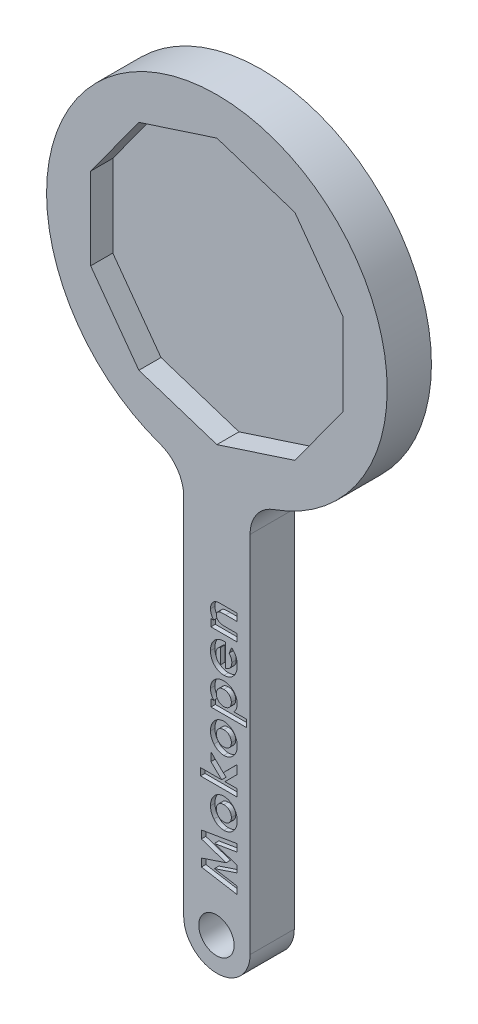
from build123d import *

# Parameters (mm, degrees)
SCHIZZO1_R                   = 4
ESTRUSIONE_ESTRUSIONE1_DEPTH = 10
TAGLIO_ESTRUSIONE1_DEPTH     = 5
TAGLIO_ESTRUSIONE2_START     = 9
TAGLIO_ESTRUSIONE2_DEPTH     = 1


# Read off the part's stored shape, not the designer's step: Taglio-Estrusione2
with BuildPart() as part:
    # Schizzo1 → Estrusione-Estrusione1 (new body)
    with BuildSketch(Plane.XY):
        with BuildLine():
            Line((-7.5, -43.840620434), (-7.5, -126.1))
            ThreePointArc((-7.5, -126.1), (-5.332590181, -131.332590181), (-0.1, -133.5))
            Line((-0.1, -133.5), (0.1, -133.5))
            ThreePointArc((0.1, -133.5), (5.332590181, -131.332590181), (7.5, -126.1))
            Line((7.5, -126.1), (7.5, -43.840620434))
            ThreePointArc((7.5, -43.840620434), (8.968027353, -39.22181828), (12.833333333, -36.298148101))
            ThreePointArc((12.833333333, -36.298148101), (0, 38.5), (-12.833333333, -36.298148101))
            ThreePointArc((-12.833333333, -36.298148101), (-8.968027353, -39.22181828), (-7.5, -43.840620434))
        make_face()
        with Locations((-0.1, -126.1)):
            Circle(SCHIZZO1_R, mode=Mode.SUBTRACT)
    extrude(amount=ESTRUSIONE_ESTRUSIONE1_DEPTH)

    # Schizzo3 → Taglio-Estrusione1 (cut)
    with BuildSketch(Plane.XY.offset(10)):
        Polygon((0, -30), (17.633557569, -24.270509831), (28.531695489, -9.270509831), (28.531695489, 9.270509831), (17.633557569, 24.270509831), (0, 30), (-17.633557569, 24.270509831), (-28.531695489, 9.270509831), (-28.531695489, -9.270509831), (-17.633557569, -24.270509831), align=None)
    extrude(amount=-TAGLIO_ESTRUSIONE1_DEPTH, mode=Mode.SUBTRACT)

    # Taglio-Estrusione2 outline → Taglio-Estrusione2 (cut)
    # profile 1 of 7: a face of its own
    with BuildSketch(Plane.XY.offset(TAGLIO_ESTRUSIONE2_START)):
        with BuildLine():
            add(Edge.make_bspline(
                [(-0.727564103, -64.715384615), (-0.791230464, -64.628577828), (-0.912682665, -64.462982133), (-1.06886137, -64.212550361), (-1.197241016, -63.976467599), (-1.293635916, -63.748099177), (-1.363799756, -63.525195402), (-1.411046694, -63.302362359), (-1.443701724, -63.077992027), (-1.447046489, -62.927037959), (-1.448717949, -62.851602564)],
                knots=[0, 0, 0, 0, 0.158475496, 0.302313455, 0.4342849, 0.553795562, 0.666749821, 0.77784251, 0.888982535, 1, 1, 1, 1], degree=3))
            Line((-0.727564103, -64.715384615), (-1.346153846, -64.715384615))
            Line((-1.346153846, -64.715384615), (-1.346153846, -66.356410256))
            Line((-1.346153846, -66.356410256), (4.5, -66.356410256))
            Line((4.5, -66.356410256), (4.5, -64.715384615))
            Line((4.5, -64.715384615), (2.173076923, -64.715384615))
            add(Edge.make_bspline(
                [(0.996794872, -64.648076923), (1.022897257, -64.653854389), (1.081110823, -64.666739301), (1.1794566, -64.677329025), (1.296661866, -64.692164903), (1.433795403, -64.697474402), (1.590700772, -64.707262655), (1.767088391, -64.710734034), (1.963659968, -64.714313386), (2.100958688, -64.715015709), (2.173076923, -64.715384615)],
                knots=[0, 0, 0, 0, 0.067920311, 0.151475949, 0.251213346, 0.36821016, 0.500124119, 0.650932111, 0.816646797, 1, 1, 1, 1], degree=3))
            add(Edge.make_bspline(
                [(-0.115384615, -63.393269231), (-0.111594302, -63.46784717), (-0.104179712, -63.613736118), (-0.04850242, -63.824834571), (0.046677616, -64.018051013), (0.176043741, -64.19407126), (0.338563785, -64.348658521), (0.532993404, -64.47503314), (0.753075068, -64.580006283), (0.913665181, -64.624858903), (0.996794872, -64.648076923)],
                knots=[0, 0, 0, 0, 0.122997731, 0.240607473, 0.357315011, 0.476513259, 0.599359242, 0.725282592, 0.857792159, 1, 1, 1, 1], degree=3))
            add(Edge.make_bspline(
                [(1.961538462, -62.356410256), (1.87873824, -62.356713769), (1.720066984, -62.357295394), (1.492985015, -62.361765098), (1.287898982, -62.370482513), (1.104442007, -62.378453766), (0.943245065, -62.39400396), (0.802826572, -62.408321655), (0.684807639, -62.429531398), (0.558069324, -62.457931526), (0.423017368, -62.506366539), (0.281586699, -62.584160392), (0.159320032, -62.679154334), (0.059068741, -62.793132468), (-0.021008711, -62.922202718), (-0.074405276, -63.067409946), (-0.109874463, -63.225435329), (-0.113501166, -63.335901202), (-0.115384615, -63.393269231)],
                knots=[0, 0, 0, 0, 0.093648971, 0.17946087, 0.256854164, 0.325825368, 0.387088765, 0.439998019, 0.48539158, 0.52261578, 0.586829024, 0.646861581, 0.704515137, 0.761011091, 0.817690887, 0.875252564, 0.935215155, 1, 1, 1, 1], degree=3))
            Line((1.961538462, -62.356410256), (4.5, -62.356410256))
            Line((4.5, -62.356410256), (4.5, -60.715384615))
            Line((4.5, -60.715384615), (0.666666667, -60.715384615))
            add(Edge.make_bspline(
                [(-0.846153846, -61.263461538), (-0.801715879, -61.21964636), (-0.712659299, -61.131837889), (-0.561043611, -61.019248988), (-0.392815025, -60.925908061), (-0.211215565, -60.847171109), (-0.012488345, -60.788163698), (0.200388048, -60.745300095), (0.428844422, -60.719315631), (0.58593483, -60.716719049), (0.666666667, -60.715384615)],
                knots=[0, 0, 0, 0, 0.112953477, 0.226366125, 0.340752995, 0.460827113, 0.584193861, 0.715520425, 0.853800376, 1, 1, 1, 1], degree=3))
            add(Edge.make_bspline(
                [(-1.448717949, -62.851602564), (-1.446958401, -62.775113978), (-1.443487951, -62.624251409), (-1.413408501, -62.402884242), (-1.367494597, -62.189707262), (-1.301624051, -61.985659092), (-1.21654489, -61.790570501), (-1.110907091, -61.605826011), (-0.989499097, -61.427657182), (-0.894322214, -61.318636273), (-0.846153846, -61.263461538)],
                knots=[0, 0, 0, 0, 0.131816611, 0.259989019, 0.384458247, 0.507367369, 0.629027946, 0.750688523, 0.873825171, 1, 1, 1, 1], degree=3))
        make_face()
    # profile 2 of 7: a face of its own
    with BuildSketch(Plane.XY.offset(TAGLIO_ESTRUSIONE2_START)):
        with BuildLine():
            add(Edge.make_bspline(
                [(1.935897436, -72.817948718), (1.989497435, -72.807557785), (2.095049893, -72.787095313), (2.247848881, -72.742657939), (2.391027139, -72.683293526), (2.527982521, -72.617307314), (2.655504322, -72.53675599), (2.77206299, -72.442080406), (2.884241318, -72.34039203), (2.984176367, -72.224173671), (3.075942531, -72.10002217), (3.154748396, -71.965478872), (3.222368976, -71.823018684), (3.276064231, -71.671804827), (3.320382606, -71.513546794), (3.350353503, -71.346145323), (3.367803511, -71.170352985), (3.370450585, -71.05036012), (3.371794872, -70.989423077)],
                knots=[0, 0, 0, 0, 0.064187982, 0.126402974, 0.186711327, 0.246269089, 0.304999526, 0.363568487, 0.42268734, 0.482785947, 0.543472617, 0.604019325, 0.665839822, 0.728632483, 0.792487627, 0.858899435, 0.928343646, 1, 1, 1, 1], degree=3))
            Line((1.935897436, -72.817948718), (1.935897436, -67.696153846))
            Line((1.935897436, -67.696153846), (1.665064103, -67.68974359))
            add(Edge.make_bspline(
                [(-1.448717949, -71.069551282), (-1.446503463, -70.947108456), (-1.442177942, -70.707942769), (-1.401121829, -70.357827601), (-1.333980766, -70.025517323), (-1.241840598, -69.710030165), (-1.120555386, -69.41277687), (-0.972688552, -69.133264277), (-0.798944069, -68.87018408), (-0.598651297, -68.627387265), (-0.377625417, -68.406960352), (-0.136684396, -68.214018415), (0.122010863, -68.05172181), (0.398128628, -67.919864738), (0.69033576, -67.816516612), (0.999783917, -67.743514696), (1.326585064, -67.697084906), (1.550586742, -67.692226504), (1.665064103, -67.68974359)],
                knots=[0, 0, 0, 0, 0.071032703, 0.138747086, 0.204224079, 0.267588028, 0.329183967, 0.390199136, 0.45081373, 0.511820237, 0.572539377, 0.631652226, 0.690569671, 0.749358938, 0.808872782, 0.870076659, 0.933601921, 1, 1, 1, 1], degree=3))
            add(Edge.make_bspline(
                [(1.608974359, -74.356410256), (1.501425169, -74.35391677), (1.289630685, -74.349006397), (0.980147695, -74.302031038), (0.683666862, -74.231041038), (0.402088636, -74.126974882), (0.132810137, -73.996344415), (-0.119468405, -73.831708124), (-0.360265965, -73.642333744), (-0.582760681, -73.423320975), (-0.784800107, -73.182409402), (-0.964682183, -72.925670016), (-1.113352699, -72.651884094), (-1.23593053, -72.364227028), (-1.333292189, -72.06197383), (-1.398437275, -71.743738526), (-1.442750444, -71.41160895), (-1.446702316, -71.185087446), (-1.448717949, -71.069551282)],
                knots=[0, 0, 0, 0, 0.064228774, 0.126484448, 0.186643148, 0.246126408, 0.305517085, 0.365110742, 0.425784735, 0.488314802, 0.551300341, 0.613464282, 0.675322562, 0.737107489, 0.800104352, 0.86471752, 0.930999845, 1, 1, 1, 1], degree=3))
            add(Edge.make_bspline(
                [(4.602564103, -70.973397436), (4.600294167, -71.095300608), (4.595840973, -71.334452098), (4.555295877, -71.684103091), (4.487640492, -72.016341375), (4.395326379, -72.331689514), (4.274898631, -72.629866795), (4.125963711, -72.909842958), (3.953464538, -73.174310647), (3.752466052, -73.416116265), (3.535074542, -73.637192255), (3.299460165, -73.829262042), (3.050312475, -73.991211684), (2.789005462, -74.126373911), (2.512714689, -74.229003932), (2.223122228, -74.302221447), (1.920315129, -74.348919941), (1.713847292, -74.353887197), (1.608974359, -74.356410256)],
                knots=[0, 0, 0, 0, 0.072280758, 0.141801485, 0.208410316, 0.273170025, 0.336416283, 0.398775475, 0.460989627, 0.523339965, 0.584948551, 0.644623783, 0.703237431, 0.760907577, 0.818754988, 0.877616431, 0.937836692, 1, 1, 1, 1], degree=3))
            add(Edge.make_bspline(
                [(3.336538462, -68.1), (3.388963516, -68.142030287), (3.493308798, -68.225686129), (3.637894331, -68.362711077), (3.775123228, -68.503189861), (3.900254128, -68.65110104), (4.014461441, -68.805161432), (4.117105487, -68.966193374), (4.21011136, -69.133185223), (4.294095241, -69.306165694), (4.36552585, -69.487240265), (4.431155619, -69.674794542), (4.482061776, -69.872013715), (4.528639242, -70.076276472), (4.56101394, -70.289004676), (4.585305659, -70.509796116), (4.59988084, -70.738692044), (4.601660017, -70.894316911), (4.602564103, -70.973397436)],
                knots=[0, 0, 0, 0, 0.061760605, 0.122926486, 0.183023893, 0.24227016, 0.300920889, 0.359239516, 0.417731648, 0.476610252, 0.535899264, 0.596635641, 0.65919006, 0.72307076, 0.789209854, 0.856906564, 0.927287302, 1, 1, 1, 1], degree=3))
            Line((3.336538462, -68.1), (2.764423077, -69.44775641))
            add(Edge.make_bspline(
                [(3.371794872, -70.989423077), (3.370088968, -70.915592193), (3.366737784, -70.77055416), (3.336013673, -70.55730588), (3.29104518, -70.351154813), (3.222740336, -70.154071613), (3.137217623, -69.964504357), (3.032540391, -69.78314519), (2.909127312, -69.608709956), (2.813073153, -69.501869562), (2.764423077, -69.44775641)],
                knots=[0, 0, 0, 0, 0.13029468, 0.255959065, 0.379758059, 0.502358177, 0.623516471, 0.746482545, 0.871596989, 1, 1, 1, 1], degree=3))
        make_face()
        with BuildLine():
            add(Edge.make_bspline(
                [(0.102564103, -72.143269231), (0.14037092, -72.195542964), (0.220395418, -72.306189127), (0.383910261, -72.4490282), (0.579561926, -72.590901475), (0.728611287, -72.67223274), (0.807692308, -72.715384615)],
                knots=[0, 0, 0, 0, 0.210392407, 0.445330976, 0.705709623, 1, 1, 1, 1], degree=3))
            add(Edge.make_bspline(
                [(-0.217948718, -70.997435897), (-0.213892525, -71.102969608), (-0.205960211, -71.30935191), (-0.145305733, -71.609090099), (-0.045591358, -71.889937005), (0.053358214, -72.059131681), (0.102564103, -72.143269231)],
                knots=[0, 0, 0, 0, 0.262422743, 0.513195349, 0.757920572, 1, 1, 1, 1], degree=3))
            add(Edge.make_bspline(
                [(0.807692308, -69.330769231), (0.734226505, -69.360155181), (0.587382471, -69.418892054), (0.389139775, -69.556481375), (0.212478803, -69.730785428), (0.060760603, -69.940333491), (-0.064646016, -70.176127521), (-0.151842743, -70.434479164), (-0.209167247, -70.709662997), (-0.214972784, -70.899913167), (-0.217948718, -70.997435897)],
                knots=[0, 0, 0, 0, 0.113493996, 0.226852707, 0.344194612, 0.46896412, 0.597487368, 0.726738696, 0.859925548, 1, 1, 1, 1], degree=3))
            Line((0.807692308, -69.330769231), (0.807692308, -72.715384615))
        make_face(mode=Mode.SUBTRACT)
    # profile 3 of 7: a face of its own
    with BuildSketch(Plane.XY.offset(TAGLIO_ESTRUSIONE2_START)):
        with BuildLine():
            add(Edge.make_bspline(
                [(-0.6875, -80.407692308), (-0.748818009, -80.336195744), (-0.869503864, -80.195476499), (-1.022809635, -79.96693327), (-1.156078255, -79.732549468), (-1.263111375, -79.488003211), (-1.348168119, -79.235148039), (-1.40359272, -78.972526124), (-1.443501499, -78.702710491), (-1.446967083, -78.519489217), (-1.448717949, -78.426923077)],
                knots=[0, 0, 0, 0, 0.129990099, 0.255845984, 0.379394754, 0.50195479, 0.623980657, 0.747143284, 0.872252989, 1, 1, 1, 1], degree=3))
            Line((-0.6875, -80.407692308), (-1.346153846, -80.407692308))
            Line((-1.346153846, -80.407692308), (-1.346153846, -82.048717949))
            Line((-1.346153846, -82.048717949), (6.653846154, -82.048717949))
            Line((6.653846154, -82.048717949), (6.653846154, -80.407692308))
            Line((6.653846154, -80.407692308), (3.83974359, -80.407692308))
            add(Edge.make_bspline(
                [(4.602564103, -78.473397436), (4.6004755, -78.562181517), (4.596358323, -78.737197916), (4.561733583, -78.994724612), (4.505612502, -79.243122303), (4.426636734, -79.483712388), (4.322530488, -79.719648615), (4.190061805, -79.952265689), (4.028977267, -80.18440712), (3.90407174, -80.331788677), (3.83974359, -80.407692308)],
                knots=[0, 0, 0, 0, 0.125029894, 0.246466275, 0.365310181, 0.483343657, 0.602615642, 0.727971218, 0.859901248, 1, 1, 1, 1], degree=3))
            add(Edge.make_bspline(
                [(1.588141026, -75.484615385), (1.692982332, -75.487428424), (1.899765316, -75.492976702), (2.203013154, -75.535588899), (2.493056021, -75.604066512), (2.769721216, -75.701161333), (3.03356042, -75.825930948), (3.282394513, -75.981811076), (3.520269731, -76.161776423), (3.739640913, -76.369619402), (3.942784239, -76.592551919), (4.118188655, -76.831779804), (4.267569258, -77.080064818), (4.390806563, -77.338452059), (4.485988351, -77.607574026), (4.552192246, -77.88756461), (4.596331732, -78.177126633), (4.600470513, -78.373873579), (4.602564103, -78.473397436)],
                knots=[0, 0, 0, 0, 0.066557253, 0.131273711, 0.194051483, 0.255525293, 0.31712906, 0.37897611, 0.441665836, 0.506225635, 0.570597117, 0.632948186, 0.694265497, 0.754352526, 0.81443381, 0.875153312, 0.936846674, 1, 1, 1, 1], degree=3))
            add(Edge.make_bspline(
                [(-1.448717949, -78.426923077), (-1.446461918, -78.326360149), (-1.442027095, -78.128677231), (-1.400813769, -77.838181203), (-1.332975344, -77.559339628), (-1.240617195, -77.291621648), (-1.120758441, -77.035119404), (-0.972263193, -76.791650113), (-0.7987893, -76.558485621), (-0.600218915, -76.339576837), (-0.381465619, -76.139033762), (-0.144680257, -75.963343259), (0.10694837, -75.814385944), (0.37457535, -75.694582232), (0.656593405, -75.598896726), (0.954210196, -75.532472746), (1.26646403, -75.491239522), (1.479569804, -75.486851139), (1.588141026, -75.484615385)],
                knots=[0, 0, 0, 0, 0.063814154, 0.125443525, 0.185817253, 0.245770426, 0.304938665, 0.365193216, 0.426508273, 0.48917397, 0.552546849, 0.614608582, 0.676027652, 0.737802411, 0.80043231, 0.864767888, 0.931103154, 1, 1, 1, 1], degree=3))
        make_face()
        with BuildLine():
            add(Edge.make_bspline(
                [(1.565705128, -77.125641026), (1.505807086, -77.127264381), (1.387724904, -77.130464641), (1.214963508, -77.153171135), (1.050229492, -77.190041083), (0.893698388, -77.241281273), (0.745419011, -77.308308974), (0.607478044, -77.393687121), (0.474604145, -77.488829918), (0.354013756, -77.601587145), (0.243745449, -77.724151629), (0.14675394, -77.855727095), (0.066753216, -77.996039345), (0.000354532, -78.143653675), (-0.052663616, -78.298489039), (-0.089885653, -78.462283677), (-0.110035621, -78.63368103), (-0.113583649, -78.7505922), (-0.115384615, -78.809935897)],
                knots=[0, 0, 0, 0, 0.067359308, 0.132791218, 0.195613966, 0.256983364, 0.31774684, 0.378128902, 0.439176876, 0.501256852, 0.563377518, 0.624425492, 0.684714817, 0.74468295, 0.806243223, 0.868480003, 0.933240913, 1, 1, 1, 1], degree=3))
            add(Edge.make_bspline(
                [(3.269230769, -78.809935897), (3.26765664, -78.751630136), (3.264568634, -78.637250361), (3.241267379, -78.469393923), (3.205045731, -78.308067917), (3.151710474, -78.154148057), (3.084080653, -78.00674262), (3.000433575, -77.867300815), (2.901662823, -77.735179107), (2.790342984, -77.611035053), (2.667426508, -77.497158708), (2.534595365, -77.398025591), (2.393457641, -77.313548096), (2.244263729, -77.244329556), (2.08600173, -77.191797648), (1.919857693, -77.15272345), (1.745255579, -77.130588294), (1.626127782, -77.12730589), (1.565705128, -77.125641026)],
                knots=[0, 0, 0, 0, 0.065295528, 0.128091763, 0.189495395, 0.250242348, 0.310218068, 0.370870629, 0.432028833, 0.494745182, 0.557421549, 0.619417177, 0.680069738, 0.74138291, 0.803262907, 0.866550488, 0.932313248, 1, 1, 1, 1], degree=3))
            add(Edge.make_bspline(
                [(1.560897436, -80.51025641), (1.622934798, -80.50866461), (1.7447503, -80.505538979), (1.922780579, -80.482572219), (2.092130466, -80.446430595), (2.252280464, -80.393138142), (2.402533552, -80.323663502), (2.545282618, -80.242066794), (2.677490169, -80.143465005), (2.798265752, -80.029527856), (2.908732692, -79.905396799), (3.004642526, -79.771853115), (3.088385481, -79.631718395), (3.152514518, -79.481649825), (3.207227603, -79.325329319), (3.243267527, -79.160140162), (3.264040497, -78.987285602), (3.267478142, -78.869822511), (3.269230769, -78.809935897)],
                knots=[0, 0, 0, 0, 0.068782188, 0.135059527, 0.19873631, 0.260556292, 0.321791641, 0.38204485, 0.442588577, 0.504201009, 0.565893131, 0.626564246, 0.686305648, 0.746515159, 0.807212297, 0.869732236, 0.933585135, 1, 1, 1, 1], degree=3))
            add(Edge.make_bspline(
                [(-0.115384615, -78.809935897), (-0.113604785, -78.869813454), (-0.11011378, -78.98725878), (-0.089726507, -79.160241752), (-0.052350442, -79.324634497), (-0.002864247, -79.482339641), (0.062676919, -79.631256542), (0.14439574, -79.771345905), (0.23689488, -79.905857813), (0.346034395, -80.029402283), (0.465042399, -80.143489162), (0.59545622, -80.241566568), (0.735185877, -80.323667814), (0.882691203, -80.393470324), (1.040400629, -80.446143373), (1.206472174, -80.482465945), (1.380762099, -80.505630403), (1.499925086, -80.508690596), (1.560897436, -80.51025641)],
                knots=[0, 0, 0, 0, 0.067046058, 0.1315058, 0.194619914, 0.255519209, 0.316300937, 0.37630989, 0.436864661, 0.498748474, 0.560510804, 0.621151151, 0.680945168, 0.741676862, 0.803517315, 0.866631429, 0.931759052, 1, 1, 1, 1], degree=3))
        make_face(mode=Mode.SUBTRACT)
    # profile 4 of 7: a face of its own
    with BuildSketch(Plane.XY.offset(TAGLIO_ESTRUSIONE2_START)):
        with BuildLine():
            add(Edge.make_bspline(
                [(-0.665064103, -88.955769231), (-0.728052672, -88.875689784), (-0.852659035, -88.717273603), (-1.01094685, -88.461917313), (-1.146004012, -88.198750636), (-1.257450946, -87.927202895), (-1.34258061, -87.646440526), (-1.40327466, -87.356891919), (-1.441171409, -87.058265855), (-1.446185875, -86.855987411), (-1.448717949, -86.753846154)],
                knots=[0, 0, 0, 0, 0.128066398, 0.253345776, 0.377151622, 0.499803444, 0.622018311, 0.74562709, 0.871553447, 1, 1, 1, 1], degree=3))
            add(Edge.make_bspline(
                [(1.581730769, -90.048717949), (1.471476641, -90.045352264), (1.25455532, -90.038730391), (0.936876705, -89.985739546), (0.632585163, -89.90124493), (0.343523229, -89.779395636), (0.066073284, -89.627074424), (-0.192958136, -89.435291363), (-0.441585268, -89.213429012), (-0.589416569, -89.042987007), (-0.665064103, -88.955769231)],
                knots=[0, 0, 0, 0, 0.127798456, 0.2514392, 0.372444516, 0.49324668, 0.614431058, 0.73859063, 0.866232834, 1, 1, 1, 1], degree=3))
            add(Edge.make_bspline(
                [(4.602564103, -86.747435897), (4.599563825, -86.859188369), (4.59364434, -87.079673694), (4.553606305, -87.40445604), (4.484217543, -87.716515251), (4.388456613, -88.016512238), (4.262040429, -88.30227344), (4.110927727, -88.577150273), (3.930414441, -88.838513605), (3.725636, -89.084850987), (3.500956571, -89.309056801), (3.264010775, -89.508568263), (3.011834316, -89.673766808), (2.749458534, -89.811801231), (2.473996176, -89.917965113), (2.186859277, -89.992582501), (1.888437884, -90.041705195), (1.685026926, -90.046356117), (1.581730769, -90.048717949)],
                knots=[0, 0, 0, 0, 0.06736488, 0.132909521, 0.196897889, 0.259833131, 0.322414773, 0.384969897, 0.448656125, 0.513594391, 0.577806817, 0.639776519, 0.699973884, 0.759171574, 0.818196468, 0.877480805, 0.937782299, 1, 1, 1, 1], degree=3))
            add(Edge.make_bspline(
                [(1.572115385, -83.382051282), (1.63947762, -83.383152494), (1.773462607, -83.385342829), (1.972722572, -83.406982924), (2.168798761, -83.442033746), (2.360903996, -83.49201799), (2.549963023, -83.554999526), (2.735650667, -83.63135233), (2.917245551, -83.724278395), (3.096279985, -83.827247061), (3.268091438, -83.943584417), (3.431340296, -84.071123071), (3.58410903, -84.209028694), (3.73049951, -84.354599533), (3.862034676, -84.514103836), (3.986648501, -84.68173721), (4.10193706, -84.859025234), (4.205886795, -85.046662249), (4.298168639, -85.241830337), (4.380450771, -85.442119835), (4.449372409, -85.647719768), (4.505516691, -85.858067681), (4.548977589, -86.073225015), (4.578769164, -86.293807042), (4.599011857, -86.518962067), (4.601375739, -86.671002578), (4.602564103, -86.747435897)],
                knots=[0, 0, 0, 0, 0.040095759, 0.079751358, 0.119180546, 0.158600753, 0.197826729, 0.237755621, 0.278010016, 0.31919726, 0.360658682, 0.401442368, 0.442436351, 0.483144313, 0.524234425, 0.565392185, 0.607473588, 0.650043764, 0.693008959, 0.735948247, 0.77889578, 0.822023131, 0.865499744, 0.909491028, 0.954499619, 1, 1, 1, 1], degree=3))
            add(Edge.make_bspline(
                [(-1.448717949, -86.753846154), (-1.447484367, -86.679552933), (-1.445021964, -86.531253276), (-1.425244607, -86.310773549), (-1.393427777, -86.09345413), (-1.347762417, -85.880252176), (-1.292690222, -85.669323878), (-1.221206084, -85.463367075), (-1.139609724, -85.259480882), (-1.043632305, -85.061546529), (-0.938895952, -84.869304406), (-0.822700075, -84.687667917), (-0.698124998, -84.515862127), (-0.563195878, -84.355674442), (-0.420272465, -84.206366975), (-0.269221773, -84.066972106), (-0.106579129, -83.941392092), (0.062304338, -83.824110376), (0.238067249, -83.720371078), (0.418637614, -83.630129807), (0.602236472, -83.553428592), (0.789472, -83.489944668), (0.980493456, -83.442551741), (1.174668409, -83.406838594), (1.372375996, -83.385379185), (1.505289993, -83.383164675), (1.572115385, -83.382051282)],
                knots=[0, 0, 0, 0, 0.044315505, 0.088459944, 0.131951936, 0.175266093, 0.218478134, 0.261914045, 0.305232892, 0.349419872, 0.393064547, 0.435764723, 0.477962471, 0.519582247, 0.560604774, 0.60120675, 0.642070524, 0.683086861, 0.723804984, 0.763710614, 0.803423633, 0.842424437, 0.881534459, 0.920727489, 0.960144028, 1, 1, 1, 1], degree=3))
        make_face()
        with BuildLine():
            add(Edge.make_bspline(
                [(1.568910256, -85.023076923), (1.507942637, -85.024677603), (1.388258998, -85.027819848), (1.213381802, -85.05064516), (1.047516061, -85.087249112), (0.890437418, -85.138644734), (0.742021442, -85.206284732), (0.603025081, -85.290073084), (0.471413445, -85.386979906), (0.350667758, -85.498389106), (0.242260458, -85.622175639), (0.145074977, -85.753092471), (0.064892163, -85.89388594), (-0.001621013, -86.042425946), (-0.052456111, -86.199959416), (-0.089817667, -86.36561107), (-0.110103341, -86.539669206), (-0.113601431, -86.658178521), (-0.115384615, -86.718589744)],
                knots=[0, 0, 0, 0, 0.068156853, 0.133796599, 0.196832936, 0.257841664, 0.318248031, 0.378787137, 0.438995329, 0.500710459, 0.562069043, 0.622758235, 0.682693238, 0.742854009, 0.804430244, 0.867466581, 0.932439861, 1, 1, 1, 1], degree=3))
            add(Edge.make_bspline(
                [(3.269230769, -86.723397436), (3.267661976, -86.663494211), (3.264597027, -86.546461417), (3.241423751, -86.374814462), (3.204506771, -86.210719401), (3.154126844, -86.053301025), (3.085791668, -85.904946464), (3.003217272, -85.764632635), (2.907083681, -85.630696222), (2.795065367, -85.506895331), (2.67234934, -85.393577922), (2.540591452, -85.292900273), (2.399195337, -85.210040465), (2.24953678, -85.141323821), (2.091253186, -85.089503201), (1.924679364, -85.05011745), (1.749528978, -85.027963969), (1.629866895, -85.024726242), (1.568910256, -85.023076923)],
                knots=[0, 0, 0, 0, 0.066697631, 0.13030701, 0.192512644, 0.253844459, 0.31401105, 0.374006805, 0.434936231, 0.497286784, 0.559597588, 0.620756035, 0.681566263, 0.741732854, 0.803816038, 0.866734492, 0.932113688, 1, 1, 1, 1], degree=3))
            add(Edge.make_bspline(
                [(1.568910256, -88.407692308), (1.630945039, -88.406105863), (1.752225426, -88.403004302), (1.92925228, -88.380176941), (2.097121795, -88.343205875), (2.256572235, -88.292531866), (2.406227129, -88.224631219), (2.54661127, -88.142013605), (2.679132169, -88.045925392), (2.799869025, -87.933400539), (2.910065326, -87.810759567), (3.007195129, -87.679255586), (3.087070521, -87.538119655), (3.155168291, -87.391198108), (3.206540676, -87.235170739), (3.243466785, -87.072087918), (3.264059292, -86.90020155), (3.267479252, -86.783278849), (3.269230769, -86.723397436)],
                knots=[0, 0, 0, 0, 0.069255573, 0.13539731, 0.198929807, 0.260989214, 0.321856174, 0.382008738, 0.442615024, 0.504245845, 0.565917063, 0.626523349, 0.686376475, 0.746700323, 0.807059547, 0.869427766, 0.933128043, 1, 1, 1, 1], degree=3))
            add(Edge.make_bspline(
                [(-0.115384615, -86.718589744), (-0.11361895, -86.777939491), (-0.110156242, -86.894332373), (-0.089636967, -87.065120462), (-0.053081956, -87.228054746), (0.001231347, -87.38236822), (0.06596247, -87.531039858), (0.148629823, -87.670770937), (0.245769801, -87.802860256), (0.355449834, -87.927661597), (0.477805771, -88.039826945), (0.608365775, -88.139663306), (0.749377084, -88.220629768), (0.896649212, -88.290643843), (1.053191929, -88.343591514), (1.21819025, -88.380067617), (1.390924349, -88.402893564), (1.509010301, -88.406077323), (1.568910256, -88.407692308)],
                knots=[0, 0, 0, 0, 0.066658422, 0.130726182, 0.192869116, 0.25376892, 0.314194095, 0.374693676, 0.435649596, 0.498124655, 0.560958727, 0.621790531, 0.682290112, 0.74321355, 0.804680997, 0.867409016, 0.932742262, 1, 1, 1, 1], degree=3))
        make_face(mode=Mode.SUBTRACT)
    # profile 5 of 7: a face of its own
    with BuildSketch(Plane.XY.offset(TAGLIO_ESTRUSIONE2_START)):
        with BuildLine():
            add(Edge.make_bspline(
                [(-0.665064103, -103.622435897), (-0.728052672, -103.542356451), (-0.852659035, -103.38394027), (-1.01094685, -103.12858398), (-1.146004012, -102.865417303), (-1.257450946, -102.593869562), (-1.34258061, -102.313107192), (-1.40327466, -102.023558585), (-1.441171409, -101.724932522), (-1.446185875, -101.522654078), (-1.448717949, -101.420512821)],
                knots=[0, 0, 0, 0, 0.128066398, 0.253345776, 0.377151622, 0.499803444, 0.622018311, 0.74562709, 0.871553447, 1, 1, 1, 1], degree=3))
            add(Edge.make_bspline(
                [(1.581730769, -104.715384615), (1.471476641, -104.71201893), (1.25455532, -104.705397057), (0.936876705, -104.652406213), (0.632585163, -104.567911597), (0.343523229, -104.446062303), (0.066073284, -104.293741091), (-0.192958136, -104.101958029), (-0.441585268, -103.880095679), (-0.589416569, -103.709653674), (-0.665064103, -103.622435897)],
                knots=[0, 0, 0, 0, 0.127798456, 0.2514392, 0.372444516, 0.49324668, 0.614431058, 0.73859063, 0.866232834, 1, 1, 1, 1], degree=3))
            add(Edge.make_bspline(
                [(4.602564103, -101.414102564), (4.599563825, -101.525855036), (4.59364434, -101.74634036), (4.553606305, -102.071122707), (4.484217543, -102.383181917), (4.388456613, -102.683178905), (4.262040429, -102.968940106), (4.110927727, -103.24381694), (3.930414441, -103.505180272), (3.725636, -103.751517653), (3.500956571, -103.975723467), (3.264010775, -104.17523493), (3.011834316, -104.340433475), (2.749458534, -104.478467898), (2.473996176, -104.58463178), (2.186859277, -104.659249167), (1.888437884, -104.708371861), (1.685026926, -104.713022784), (1.581730769, -104.715384615)],
                knots=[0, 0, 0, 0, 0.06736488, 0.132909521, 0.196897889, 0.259833131, 0.322414773, 0.384969897, 0.448656125, 0.513594391, 0.577806817, 0.639776519, 0.699973884, 0.759171574, 0.818196468, 0.877480805, 0.937782299, 1, 1, 1, 1], degree=3))
            add(Edge.make_bspline(
                [(1.572115385, -98.048717949), (1.63947762, -98.049819161), (1.773462607, -98.052009496), (1.972722572, -98.073649591), (2.168798761, -98.108700413), (2.360903996, -98.158684656), (2.549963023, -98.221666192), (2.735650667, -98.298018997), (2.917245551, -98.390945061), (3.096279985, -98.493913727), (3.268091438, -98.610251084), (3.431340296, -98.737789738), (3.58410903, -98.875695361), (3.73049951, -99.0212662), (3.862034676, -99.180770503), (3.986648501, -99.348403877), (4.10193706, -99.525691901), (4.205886795, -99.713328916), (4.298168639, -99.908497004), (4.380450771, -100.108786501), (4.449372409, -100.314386434), (4.505516691, -100.524734348), (4.548977589, -100.739891682), (4.578769164, -100.960473709), (4.599011857, -101.185628733), (4.601375739, -101.337669245), (4.602564103, -101.414102564)],
                knots=[0, 0, 0, 0, 0.040095759, 0.079751358, 0.119180546, 0.158600753, 0.197826729, 0.237755621, 0.278010016, 0.31919726, 0.360658682, 0.401442368, 0.442436351, 0.483144313, 0.524234425, 0.565392185, 0.607473588, 0.650043764, 0.693008959, 0.735948247, 0.77889578, 0.822023131, 0.865499744, 0.909491028, 0.954499619, 1, 1, 1, 1], degree=3))
            add(Edge.make_bspline(
                [(-1.448717949, -101.420512821), (-1.447484367, -101.3462196), (-1.445021964, -101.197919943), (-1.425244607, -100.977440215), (-1.393427777, -100.760120797), (-1.347762417, -100.546918843), (-1.292690222, -100.335990544), (-1.221206084, -100.130033741), (-1.139609724, -99.926147548), (-1.043632305, -99.728213195), (-0.938895952, -99.535971073), (-0.822700075, -99.354334583), (-0.698124998, -99.182528794), (-0.563195878, -99.022341109), (-0.420272465, -98.873033642), (-0.269221773, -98.733638773), (-0.106579129, -98.608058759), (0.062304338, -98.490777043), (0.238067249, -98.387037744), (0.418637614, -98.296796474), (0.602236472, -98.220095258), (0.789472, -98.156611334), (0.980493456, -98.109218408), (1.174668409, -98.073505261), (1.372375996, -98.052045851), (1.505289993, -98.049831341), (1.572115385, -98.048717949)],
                knots=[0, 0, 0, 0, 0.044315505, 0.088459944, 0.131951936, 0.175266093, 0.218478134, 0.261914045, 0.305232892, 0.349419872, 0.393064547, 0.435764723, 0.477962471, 0.519582247, 0.560604774, 0.60120675, 0.642070524, 0.683086861, 0.723804984, 0.763710614, 0.803423633, 0.842424437, 0.881534459, 0.920727489, 0.960144028, 1, 1, 1, 1], degree=3))
        make_face()
        with BuildLine():
            add(Edge.make_bspline(
                [(1.568910256, -99.68974359), (1.507942637, -99.69134427), (1.388258998, -99.694486514), (1.213381802, -99.717311827), (1.047516061, -99.753915778), (0.890437418, -99.805311401), (0.742021442, -99.872951398), (0.603025081, -99.956739751), (0.471413445, -100.053646573), (0.350667758, -100.165055773), (0.242260458, -100.288842306), (0.145074977, -100.419759138), (0.064892163, -100.560552607), (-0.001621013, -100.709092613), (-0.052456111, -100.866626083), (-0.089817667, -101.032277737), (-0.110103341, -101.206335873), (-0.113601431, -101.324845188), (-0.115384615, -101.38525641)],
                knots=[0, 0, 0, 0, 0.068156853, 0.133796599, 0.196832936, 0.257841664, 0.318248031, 0.378787137, 0.438995329, 0.500710459, 0.562069043, 0.622758235, 0.682693238, 0.742854009, 0.804430244, 0.867466581, 0.932439861, 1, 1, 1, 1], degree=3))
            add(Edge.make_bspline(
                [(3.269230769, -101.390064103), (3.267661976, -101.330160878), (3.264597027, -101.213128084), (3.241423751, -101.041481129), (3.204506771, -100.877386068), (3.154126844, -100.719967692), (3.085791668, -100.57161313), (3.003217272, -100.431299302), (2.907083681, -100.297362888), (2.795065367, -100.173561998), (2.67234934, -100.060244589), (2.540591452, -99.95956694), (2.399195337, -99.876707132), (2.24953678, -99.807990488), (2.091253186, -99.756169868), (1.924679364, -99.716784117), (1.749528978, -99.694630636), (1.629866895, -99.691392909), (1.568910256, -99.68974359)],
                knots=[0, 0, 0, 0, 0.066697631, 0.13030701, 0.192512644, 0.253844459, 0.31401105, 0.374006805, 0.434936231, 0.497286784, 0.559597588, 0.620756035, 0.681566263, 0.741732854, 0.803816038, 0.866734492, 0.932113688, 1, 1, 1, 1], degree=3))
            add(Edge.make_bspline(
                [(1.568910256, -103.074358974), (1.630945039, -103.072772529), (1.752225426, -103.069670968), (1.92925228, -103.046843608), (2.097121795, -103.009872541), (2.256572235, -102.959198532), (2.406227129, -102.891297886), (2.54661127, -102.808680272), (2.679132169, -102.712592059), (2.799869025, -102.600067206), (2.910065326, -102.477426233), (3.007195129, -102.345922252), (3.087070521, -102.204786322), (3.155168291, -102.057864775), (3.206540676, -101.901837406), (3.243466785, -101.738754584), (3.264059292, -101.566868217), (3.267479252, -101.449945516), (3.269230769, -101.390064103)],
                knots=[0, 0, 0, 0, 0.069255573, 0.13539731, 0.198929807, 0.260989214, 0.321856174, 0.382008738, 0.442615024, 0.504245845, 0.565917063, 0.626523349, 0.686376475, 0.746700323, 0.807059547, 0.869427766, 0.933128043, 1, 1, 1, 1], degree=3))
            add(Edge.make_bspline(
                [(-0.115384615, -101.38525641), (-0.11361895, -101.444606158), (-0.110156242, -101.560999039), (-0.089636967, -101.731787129), (-0.053081956, -101.894721413), (0.001231347, -102.049034887), (0.06596247, -102.197706524), (0.148629823, -102.337437603), (0.245769801, -102.469526923), (0.355449834, -102.594328263), (0.477805771, -102.706493612), (0.608365775, -102.806329973), (0.749377084, -102.887296434), (0.896649212, -102.957310509), (1.053191929, -103.010258181), (1.21819025, -103.046734284), (1.390924349, -103.069560231), (1.509010301, -103.07274399), (1.568910256, -103.074358974)],
                knots=[0, 0, 0, 0, 0.066658422, 0.130726182, 0.192869116, 0.25376892, 0.314194095, 0.374693676, 0.435649596, 0.498124655, 0.560958727, 0.621790531, 0.682290112, 0.74321355, 0.804680997, 0.867409016, 0.932742262, 1, 1, 1, 1], degree=3))
        make_face(mode=Mode.SUBTRACT)
    # profile 6 of 7: a face of its own
    with BuildSketch(Plane.XY.offset(TAGLIO_ESTRUSIONE2_START)):
        Polygon((-1.346153846, -90.809935897), (-1.346153846, -92.733012821), (1.080128205, -95.074358974), (-3.705128205, -95.074358974), (-3.705128205, -96.715384615), (4.5, -96.715384615), (4.5, -95.074358974), (1.822115385, -95.074358974), (4.5, -92.383653846), (4.5, -90.426923077), (1.440705128, -93.50224359), align=None)
    # profile 7 of 7: a face of its own
    with BuildSketch(Plane.XY.offset(TAGLIO_ESTRUSIONE2_START)):
        Polygon((4.5, -107.507051282), (4.5, -105.843589744), (-3.5, -107.191346154), (-3.5, -108.949358974), (2.080128205, -110.817948718), (-3.5, -112.681730769), (-3.5, -114.449358974), (4.5, -115.792307692), (4.5, -114.12724359), (-0.552884615, -113.279487179), (4.5, -111.593589744), (4.5, -110.048717949), (-0.552884615, -108.356410256), align=None)
    extrude(amount=TAGLIO_ESTRUSIONE2_DEPTH, mode=Mode.SUBTRACT)


solid = part.part
